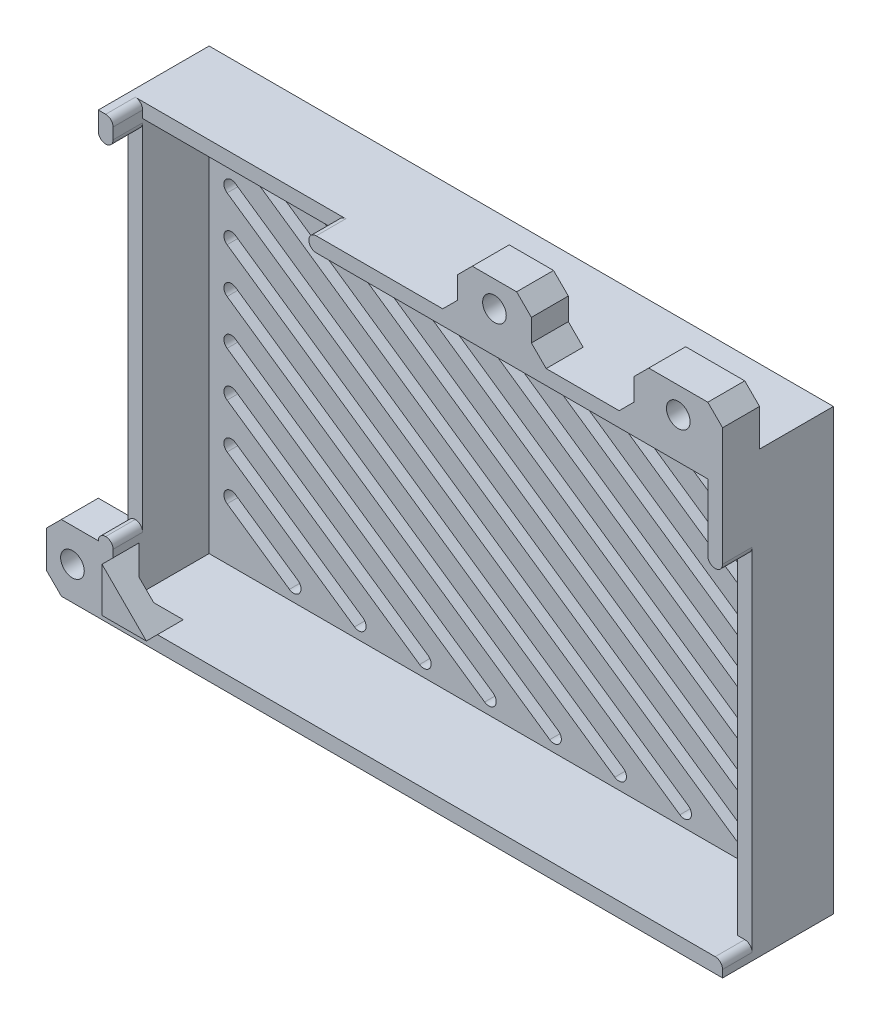
from build123d import *

# Parameters (mm, degrees)
SKETCH_1_W          = 84.5
SKETCH_1_H          = 59.5
EXTRUDE_1_DEPTH     = 2
SKETCH_2_W          = 84.5
SKETCH_2_H          = 59.5
SKETCH_2_W_2        = 80.5
SKETCH_2_H_2        = 55.5
EXTRUDE_2_DEPTH     = 13
SKETCH_3_W          = 26.5
SKETCH_3_H          = 4
CUT_EXTRUDE_1_DEPTH = 2
SKETCH_4_W          = 4
SKETCH_4_H          = 46
CUT_EXTRUDE_2_DEPTH = 2
SKETCH_5_W          = 4
SKETCH_5_H          = 45.5
CUT_EXTRUDE_3_DEPTH = 2
CUT_EXTRUDE_4_DEPTH = 105.160933176
SKETCH_9_W          = 7
SKETCH_9_H          = 9
SKETCH_9_R          = 1.6
EXTRUDE_5_DEPTH     = 5
FILLET_1_R          = 1
EXTRUDE_8_DEPTH     = 3
CHAMFER_4_SIZE      = 2
SKETCH_16_W         = 12
SKETCH_16_H         = 7
SKETCH_16_R         = 1.6
SKETCH_16_W_2       = 10
EXTRUDE_9_DEPTH     = 5
CHAMFER_5_SIZE      = 2


with BuildPart() as part:
    # 草图1 → 凸台-拉伸1 (new body)
    with BuildSketch(Plane.XY):
        with Locations((42.25, 29.75)):
            Rectangle(SKETCH_1_W, SKETCH_1_H)
    extrude(amount=EXTRUDE_1_DEPTH)

    # 草图2 → 凸台-拉伸2 (add)
    with BuildSketch(Plane.XY.offset(2)):
        with Locations((42.25, 29.75)):
            Rectangle(SKETCH_2_W, SKETCH_2_H)
        with Locations((42.25, 29.75)):
            Rectangle(SKETCH_2_W_2, SKETCH_2_H_2, mode=Mode.SUBTRACT)
    extrude(amount=EXTRUDE_2_DEPTH)

    # 草图3 → 切除-拉伸1 (cut)
    with BuildSketch(Plane(origin=(0, 59.5, 0), x_dir=(1, 0, 0), z_dir=(0, 1, 0))):
        with Locations((15.25, -13)):
            Rectangle(SKETCH_3_W, SKETCH_3_H)
    extrude(amount=-CUT_EXTRUDE_1_DEPTH, mode=Mode.SUBTRACT)

    # 草图4 → 切除-拉伸2 (cut)
    with BuildSketch(Plane.ZY):
        with Locations((13, 33)):
            Rectangle(SKETCH_4_W, SKETCH_4_H)
    extrude(amount=-CUT_EXTRUDE_2_DEPTH, mode=Mode.SUBTRACT)

    # 草图5 → 切除-拉伸3 (cut)
    with BuildSketch(Plane(origin=(84.5, 0, 0), x_dir=(0, 0, -1), z_dir=(1, 0, 0))):
        with Locations((-13, 24.75)):
            Rectangle(SKETCH_5_W, SKETCH_5_H)
    extrude(amount=-CUT_EXTRUDE_3_DEPTH, mode=Mode.SUBTRACT)

    # 草图6 → 切除-拉伸4 (cut, through all)
    with BuildSketch(Plane.XY.offset(2)):
        with BuildLine():
            Line((5.567613453, 16.779459118), (22.810337711, 4.89161817))
            ThreePointArc((22.810337711, 4.89161817), (23.066019447, 3.500709528), (21.675110805, 3.245027793))
            Line((21.675110805, 3.245027793), (4.432386547, 15.132868741))
            ThreePointArc((4.432386547, 15.132868741), (4.176704811, 16.523777383), (5.567613453, 16.779459118))
        make_face()
        with BuildLine():
            Line((5.567613453, 22.852614978), (31.619149364, 4.89161817))
            ThreePointArc((31.619149364, 4.89161817), (31.8748311, 3.500709528), (30.483922458, 3.245027793))
            Line((30.483922458, 3.245027793), (4.432386547, 21.206024601))
            ThreePointArc((4.432386547, 21.206024601), (4.176704811, 22.596933243), (5.567613453, 22.852614978))
        make_face()
        with BuildLine():
            Line((5.567613453, 28.925770838), (40.427961017, 4.89161817))
            ThreePointArc((40.427961017, 4.89161817), (40.683642752, 3.500709528), (39.29273411, 3.245027793))
            Line((39.29273411, 3.245027793), (4.432386547, 27.279180461))
            ThreePointArc((4.432386547, 27.279180461), (4.176704811, 28.670089102), (5.567613453, 28.925770838))
        make_face()
        with BuildLine():
            Line((5.567613453, 34.998926698), (49.236772669, 4.89161817))
            ThreePointArc((49.236772669, 4.89161817), (49.492454405, 3.500709528), (48.101545763, 3.245027793))
            Line((48.101545763, 3.245027793), (4.432386547, 33.35233632))
            ThreePointArc((4.432386547, 33.35233632), (4.176704811, 34.743244962), (5.567613453, 34.998926698))
        make_face()
        with BuildLine():
            Line((5.567613453, 41.072082558), (58.045584322, 4.89161817))
            ThreePointArc((58.045584322, 4.89161817), (58.301266057, 3.500709528), (56.910357415, 3.245027793))
            Line((56.910357415, 3.245027793), (4.432386547, 39.42549218))
            ThreePointArc((4.432386547, 39.42549218), (4.176704811, 40.816400822), (5.567613453, 41.072082558))
        make_face()
        with BuildLine():
            Line((5.567613453, 47.145238418), (66.854395974, 4.89161817))
            ThreePointArc((66.854395974, 4.89161817), (67.11007771, 3.500709528), (65.719169068, 3.245027793))
            Line((65.719169068, 3.245027793), (4.432386547, 45.49864804))
            ThreePointArc((4.432386547, 45.49864804), (4.176704811, 46.889556682), (5.567613453, 47.145238418))
        make_face()
        with BuildLine():
            Line((9.972019279, 56.254972207), (80.067613453, 7.9281961))
            ThreePointArc((80.067613453, 7.9281961), (80.323295189, 6.537287458), (78.932386547, 6.281605723))
            Line((78.932386547, 6.281605723), (8.836792373, 54.60838183))
            ThreePointArc((8.836792373, 54.60838183), (8.581110638, 55.999290472), (9.972019279, 56.254972207))
        make_face()
        with BuildLine():
            Line((5.567613453, 53.218394277), (75.663207627, 4.89161817))
            ThreePointArc((75.663207627, 4.89161817), (75.918889362, 3.500709528), (74.527980721, 3.245027793))
            Line((74.527980721, 3.245027793), (4.432386547, 51.5718039))
            ThreePointArc((4.432386547, 51.5718039), (4.176704811, 52.962712542), (5.567613453, 53.218394277))
        make_face()
        with BuildLine():
            Line((5.567613453, 10.706303259), (14.001526059, 4.89161817))
            ThreePointArc((14.001526059, 4.89161817), (14.257207795, 3.500709528), (12.866299153, 3.245027793))
            Line((12.866299153, 3.245027793), (4.432386547, 9.059712881))
            ThreePointArc((4.432386547, 9.059712881), (4.176704811, 10.450621523), (5.567613453, 10.706303259))
        make_face()
        with BuildLine():
            Line((18.780830932, 56.254972207), (80.067613453, 14.00135196))
            ThreePointArc((80.067613453, 14.00135196), (80.323295189, 12.610443318), (78.932386547, 12.354761582))
            Line((78.932386547, 12.354761582), (17.645604026, 54.60838183))
            ThreePointArc((17.645604026, 54.60838183), (17.38992229, 55.999290472), (18.780830932, 56.254972207))
        make_face()
        with BuildLine():
            Line((27.589642585, 56.254972207), (80.067613453, 20.07450782))
            ThreePointArc((80.067613453, 20.07450782), (80.323295189, 18.683599178), (78.932386547, 18.427917442))
            Line((78.932386547, 18.427917442), (26.454415678, 54.60838183))
            ThreePointArc((26.454415678, 54.60838183), (26.198733943, 55.999290472), (27.589642585, 56.254972207))
        make_face()
        with BuildLine():
            Line((36.398454237, 56.254972207), (80.067613453, 26.14766368))
            ThreePointArc((80.067613453, 26.14766368), (80.323295189, 24.756755038), (78.932386547, 24.501073302))
            Line((78.932386547, 24.501073302), (35.263227331, 54.60838183))
            ThreePointArc((35.263227331, 54.60838183), (35.007545595, 55.999290472), (36.398454237, 56.254972207))
        make_face()
        with BuildLine():
            Line((45.20726589, 56.254972207), (80.067613453, 32.220819539))
            ThreePointArc((80.067613453, 32.220819539), (80.323295189, 30.829910898), (78.932386547, 30.574229162))
            Line((78.932386547, 30.574229162), (44.072038983, 54.60838183))
            ThreePointArc((44.072038983, 54.60838183), (43.816357248, 55.999290472), (45.20726589, 56.254972207))
        make_face()
        with BuildLine():
            Line((54.016077542, 56.254972207), (80.067613453, 38.293975399))
            ThreePointArc((80.067613453, 38.293975399), (80.323295189, 36.903066757), (78.932386547, 36.647385022))
            Line((78.932386547, 36.647385022), (52.880850636, 54.60838183))
            ThreePointArc((52.880850636, 54.60838183), (52.6251689, 55.999290472), (54.016077542, 56.254972207))
        make_face()
        with BuildLine():
            Line((62.824889195, 56.254972207), (80.067613453, 44.367131259))
            ThreePointArc((80.067613453, 44.367131259), (80.323295189, 42.976222617), (78.932386547, 42.720540882))
            Line((78.932386547, 42.720540882), (61.689662289, 54.60838183))
            ThreePointArc((61.689662289, 54.60838183), (61.433980553, 55.999290472), (62.824889195, 56.254972207))
        make_face()
        with BuildLine():
            Line((71.633700847, 56.254972207), (80.067613453, 50.440287119))
            ThreePointArc((80.067613453, 50.440287119), (80.323295189, 49.049378477), (78.932386547, 48.793696741))
            Line((78.932386547, 48.793696741), (70.498473941, 54.60838183))
            ThreePointArc((70.498473941, 54.60838183), (70.242792205, 55.999290472), (71.633700847, 56.254972207))
        make_face()
    extrude(amount=-CUT_EXTRUDE_4_DEPTH, mode=Mode.SUBTRACT)

    # 草图9 → 凸台-拉伸5 (add)
    with BuildSketch(Plane.XY.offset(15)):
        with Locations((-3.5, 4.5)):
            Rectangle(SKETCH_9_W, SKETCH_9_H)
        with Locations((-3.5, 4.5)):
            Circle(SKETCH_9_R, mode=Mode.SUBTRACT)
    extrude(amount=-EXTRUDE_5_DEPTH)

    # 圆角1
    fillet_1_edges = [part.edges().sort_by_distance(p)[0] for p in [
        (2, 10, 13),
        (84.5, 47.5, 13),
        (82.5, 47.5, 13),
        (84.5, 2, 13),
        (28.5, 57.5, 13),
        (28.5, 59.5, 13),
        (2, 59.5, 13),
        (2, 56, 13),
        (0, 56, 13),
        (0, 10, 13),
    ]]
    fillet(fillet_1_edges, radius=FILLET_1_R - 0.0001)  # a hair under: the kernel refuses the full size

    # 草图15 → 凸台-拉伸8 (add)
    with BuildSketch(Plane.XY.offset(16.5)):
        Polygon((2, 2), (2, 8), (8, 2), align=None)
    extrude(amount=-EXTRUDE_8_DEPTH)

    # 倒角4
    chamfer_4_edges = [part.edges().sort_by_distance(p)[0] for p in [
        (5, 2, 13.5),
        (2, 5, 13.5),
    ]]
    chamfer(chamfer_4_edges, length=CHAMFER_4_SIZE)

    # 草图16 → 凸台-拉伸9 (add)
    # profile 1 of 2: a face of its own
    with BuildSketch(Plane.XY.offset(15)):
        with Locations((78.5, 63)):
            Rectangle(SKETCH_16_W, SKETCH_16_H)
        with Locations((78.5, 63)):
            Circle(SKETCH_16_R, mode=Mode.SUBTRACT)
    # profile 2 of 2: a face of its own
    with BuildSketch(Plane.XY.offset(15)):
        with Locations((53.62, 63)):
            Rectangle(SKETCH_16_W_2, SKETCH_16_H)
        with Locations((53.62, 63)):
            Circle(SKETCH_16_R, mode=Mode.SUBTRACT)
    extrude(amount=-EXTRUDE_9_DEPTH)

    # 倒角5
    chamfer_5_edges = [part.edges().sort_by_distance(p)[0] for p in [
        (-7, 0, 12.5),
        (-7, 9, 12.5),
        (84.5, 66.5, 12.5),
        (72.5, 59.5, 12.5),
        (72.5, 66.5, 12.5),
        (58.62, 66.5, 12.5),
        (58.62, 59.5, 12.5),
        (48.62, 59.5, 12.5),
        (48.62, 66.5, 12.5),
    ]]
    chamfer(chamfer_5_edges, length=CHAMFER_5_SIZE)


solid = part.part
